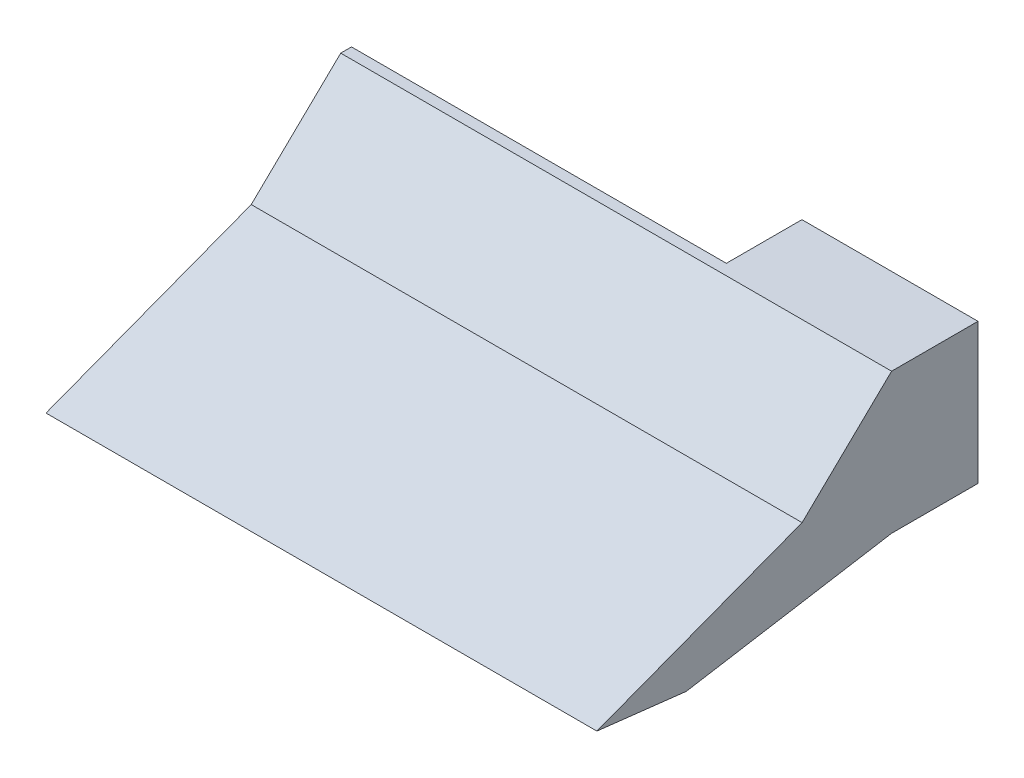
from build123d import *

# Parameters (mm, degrees)
SIDE_BASE_DEPTH            = 1
SIDE_BASE_2_COUNT          = 2
SIDE_BASE_2_PITCH          = 50
FRONT_BACK_WALLS_REACH     = 60.425
BASE_SKETCH_W              = 51
BASE_SKETCH_H              = 13
BASE_SKETCH_W_2            = 14.3
BASE_SKETCH_H_2            = 10.596042654
BASE_DEPTH                 = 1
ATTACHMENT_BASE_SKETCH_W   = 16.3
ATTACHMENT_BASE_SKETCH_H   = 13
ATTACHMENT_BASE_SKETCH_W_2 = 14.3
ATTACHMENT_BASE_SKETCH_H_2 = 10.596042654
ATTACHMENT_BASE_DEPTH      = 7


with BuildPart() as part:
    # Side base sketch → Side base (new body)
    with BuildSketch(Plane.ZY):
        Polygon((0, 13), (8.28424251, 5), (19.28424251, 0.823221326), (27.28424251, -2.214435891), (19, -3.166666667), (6, -1), (0, 0), align=None)
    extrude(amount=-SIDE_BASE_DEPTH)


with BuildPart() as side_base_2_1:
    # Side base 2: pattern copy
    add(part.part.moved(Location(Vector(1, 0, 0) * (1 * SIDE_BASE_2_PITCH))))

    # Wall base sketch → Front back walls (add, up to next)
    with BuildSketch(Plane(origin=(1, 0, 0), x_dir=(0, 0, -1), z_dir=(1, 0, 0)), mode=Mode.PRIVATE) as front_back_walls_sk1:
        Polygon((0, 11.609836409), (-7.737294895, 4.138017581), (-25.121788104, -2.462998827), (-27.28424251, -2.214435891), (-8.28424251, 5), (0, 13), align=None)
    front_back_walls_tool1 = extrude(front_back_walls_sk1.sketch, amount=FRONT_BACK_WALLS_REACH, mode=Mode.PRIVATE) - side_base_2_1.part
    # Wall base sketch → Front back walls (add, up to next)
    with BuildSketch(Plane(origin=(1, 0, 0), x_dir=(0, 0, -1), z_dir=(1, 0, 0)), mode=Mode.PRIVATE) as front_back_walls_sk2:
        Polygon((0, 1.013793755), (-19, -2.152872912), (-19, -3.166666667), (0, 0), align=None)
    front_back_walls_tool2 = extrude(front_back_walls_sk2.sketch, amount=FRONT_BACK_WALLS_REACH, mode=Mode.PRIVATE) - side_base_2_1.part

    add(part.part)  # Front back walls merges part
    add(front_back_walls_tool1.solids().sort_by_distance((1, 8.099522, 4.086502))[0])
    add(front_back_walls_tool2.solids().sort_by_distance((1, -1.076436, 9.5))[0])

    # Base sketch → Base (add)
    with BuildSketch(Plane(origin=(0, 0, 0), x_dir=(-1, 0, 0), z_dir=(0, 0, -1))):
        with Locations((-25.5, 6.5)):
            Rectangle(BASE_SKETCH_W, BASE_SKETCH_H)
        with Locations((-42.85, 6.311815082)):
            Rectangle(BASE_SKETCH_W_2, BASE_SKETCH_H_2, mode=Mode.SUBTRACT)
    extrude(amount=BASE_DEPTH)

    # Attachment base sketch → Attachment base (add)
    with BuildSketch(Plane(origin=(0, 0, -1), x_dir=(-1, 0, 0), z_dir=(0, 0, -1))):
        with Locations((-42.85, 6.5)):
            Rectangle(ATTACHMENT_BASE_SKETCH_W, ATTACHMENT_BASE_SKETCH_H)
        with Locations((-42.85, 6.311815082)):
            Rectangle(ATTACHMENT_BASE_SKETCH_W_2, ATTACHMENT_BASE_SKETCH_H_2, mode=Mode.SUBTRACT)
    extrude(amount=ATTACHMENT_BASE_DEPTH)


solid = side_base_2_1.part
